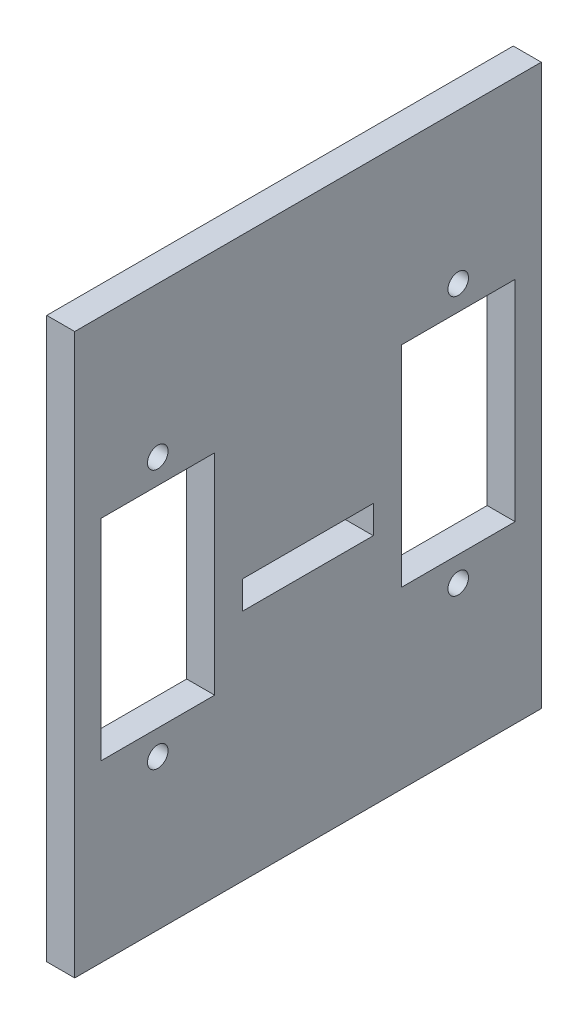
from build123d import *

# Parameters (mm, degrees)
SKETCH1_W           = 50
SKETCH1_H           = 60
SKETCH1_R           = 1.1
SKETCH1_W_2         = 12.2
SKETCH1_H_2         = 22.5
BOSS_EXTRUDE1_DEPTH = 3
SKETCH2_W           = 14
SKETCH2_H           = 3
CUT_EXTRUDE1_DEPTH  = 3


with BuildPart() as part:
    # Sketch1 → Boss-Extrude1 (new body)
    with BuildSketch(Plane(origin=(0, 0, 0), x_dir=(0, 0, -1), z_dir=(1, 0, 0))):
        Rectangle(SKETCH1_W, SKETCH1_H)
        with Locations((16.1, 13.9)):
            Circle(SKETCH1_R, mode=Mode.SUBTRACT)
        with Locations((16.1, -13.9)):
            Circle(SKETCH1_R, mode=Mode.SUBTRACT)
        with Locations((-16.1, -13.9)):
            Circle(SKETCH1_R, mode=Mode.SUBTRACT)
        with Locations((-16.1, 13.9)):
            Circle(SKETCH1_R, mode=Mode.SUBTRACT)
        with Locations((16.1, 0)):
            Rectangle(SKETCH1_W_2, SKETCH1_H_2, mode=Mode.SUBTRACT)
        with Locations((-16.1, 0)):
            Rectangle(SKETCH1_W_2, SKETCH1_H_2, mode=Mode.SUBTRACT)
    extrude(amount=BOSS_EXTRUDE1_DEPTH)

    # Sketch2 → Cut-Extrude1 (cut)
    with BuildSketch(Plane(origin=(3, 0, 0), x_dir=(0, 0, -1), z_dir=(1, 0, 0))):
        with Locations((0, -3.45)):
            Rectangle(SKETCH2_W, SKETCH2_H)
    extrude(amount=-CUT_EXTRUDE1_DEPTH, mode=Mode.SUBTRACT)


solid = part.part
